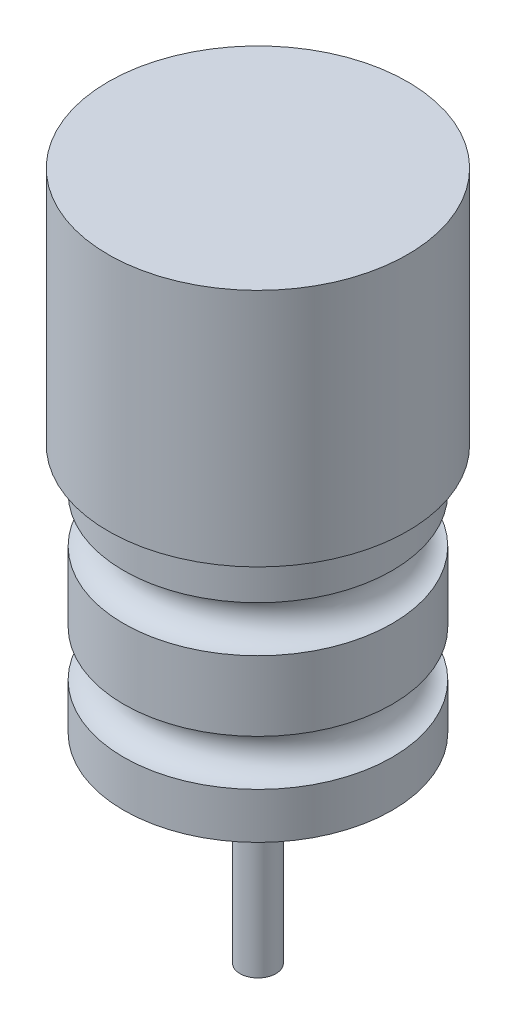
from build123d import *


with BuildPart() as part:
    # Esquisse3 → Révolution1 (revolve)
    with BuildSketch(Plane.XY):
        with BuildLine():
            Line((0, -20), (1.8, -20))
            Line((1.8, -20), (1.8, 0))
            Line((1.8, 0), (13.45, 0))
            Line((13.45, 0), (13.45, 4.6))
            ThreePointArc((13.45, 4.6), (11.15, 6.9), (13.45, 9.2))
            Line((13.45, 9.2), (13.45, 16.2))
            ThreePointArc((13.45, 16.2), (11.15, 18.5), (13.45, 20.8))
            Line((13.45, 20.8), (13.45, 25))
            Line((13.45, 25), (15, 25))
            Line((15, 25), (15, 49))
            Line((15, 49), (0, 49))
            Line((0, 49), (0, 0))
            Line((0, 0), (0, -20))
        make_face()
    revolve(axis=Axis((0, 49, 0), (0, -1, 0)))


solid = part.part
